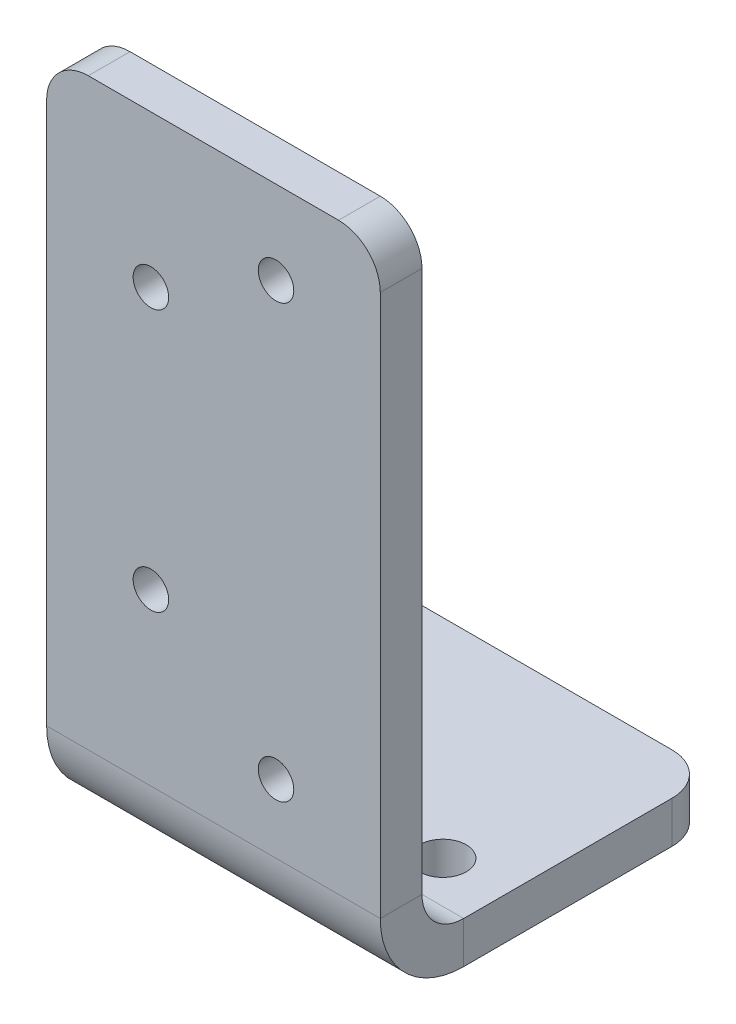
from build123d import *

# Parameters (mm, degrees)
BASE_FLANGE1_DEPTH  = 50.8
SKETCH3_R           = 2.7051
TAB1_DEPTH          = 6.35
SKETCH3_2_R         = 2.7051
CUT_EXTRUDE1_DEPTH  = 12.7
SKETCH4_R           = 3.5687
CUT_EXTRUDE2_DEPTH  = 12.7
FILLET1_R           = 6.35
UNFOLD1_START       = 6.35
UNFOLD1_OUTLINE_W   = 50.8
UNFOLD1_OUTLINE_H   = 14.961835013
UNFOLD1_DEPTH       = 95.25
UNFOLD1_2_OUTLINE_R = 2.7051
UNFOLD1_2_DEPTH     = 6.35
FOLD1_START         = -1.304798
FOLD1_DEPTH         = 92.466633013
FOLD1_START_2       = -6.35
FOLD1_2_OUTLINE_R   = 2.7051
FOLD1_2_DEPTH       = 0.034797996
FOLD1_START_3       = -12.7
FOLD1_3_OUTLINE_R   = 2.7051
FOLD1_3_DEPTH       = 12.7
FOLD1_4_DEPTH       = 50.8


with BuildPart() as part:
    # Base-Flange1: sheet metal written as solids
    # Sketch1 → Base-Flange1 (new body)
    with BuildSketch(Plane(origin=(0, 0, 0), x_dir=(0, 0, -1), z_dir=(1, 0, 0))):
        with BuildLine():
            Line((0, 101.6), (0, 12.7))
            ThreePointArc((0, 12.7), (3.719743879, 3.719743879), (12.7, 0))
            Line((12.7, 0), (50.8, 0))
            Line((50.8, 0), (50.8, 6.35))
            Line((50.8, 6.35), (12.7, 6.35))
            ThreePointArc((12.7, 6.35), (8.209871939, 8.209871939), (6.35, 12.7))
            Line((6.35, 12.7), (6.35, 101.6))
            Line((6.35, 101.6), (0, 101.6))
        make_face()
    extrude(amount=BASE_FLANGE1_DEPTH)

    # Tab1: sheet metal written as solids
    # Sketch3 → Tab1 (add)
    with BuildSketch(Plane(origin=(0, 0, -6.35), x_dir=(-1, 0, 0), z_dir=(0, 0, -1))):
        with Locations((-34.925, 23.114)):
            Circle(SKETCH3_R)
        with Locations((-34.925, 88.9)):
            Circle(SKETCH3_R)
        with Locations((-15.875, 38.608)):
            Circle(SKETCH3_R)
        with Locations((-15.875, 78.486)):
            Circle(SKETCH3_R)
    extrude(amount=-TAB1_DEPTH)

    # Sketch3<2> → Cut-Extrude1 (cut)
    with BuildSketch(Plane(origin=(0, 0, -6.35), x_dir=(-1, 0, 0), z_dir=(0, 0, -1))):
        with Locations(Location((-34.925, 23.114, 0), (0, 0, 90))):
            Circle(SKETCH3_2_R)
        with Locations(Location((-34.925, 88.9, 0), (0, 0, 90))):
            Circle(SKETCH3_2_R)
        with Locations(Location((-15.875, 38.608, 0), (0, 0, 90))):
            Circle(SKETCH3_2_R)
        with Locations(Location((-15.875, 78.486, 0), (0, 0, 90))):
            Circle(SKETCH3_2_R)
    extrude(amount=-CUT_EXTRUDE1_DEPTH, mode=Mode.SUBTRACT)

    # Sketch4 → Cut-Extrude2 (cut)
    with BuildSketch(Plane(origin=(0, 6.35, 0), x_dir=(-1, 0, 0), z_dir=(0, 1, 0))):
        with Locations(Location((-41.275, -19.05, 0), (0, 0, 90))):
            Circle(SKETCH4_R)
        with Locations(Location((-9.525, -41.275, 0), (0, 0, 90))):
            Circle(SKETCH4_R)
    extrude(amount=-CUT_EXTRUDE2_DEPTH, mode=Mode.SUBTRACT)

    # Fillet1
    fillet1_edges = [part.edges().sort_by_distance(p)[0] for p in [
        (50.8, 101.6, -3.175),
        (0, 101.6, -3.175),
        (50.8, 3.175, -50.8),
        (0, 3.175, -50.8),
    ]]
    fillet(fillet1_edges, radius=FILLET1_R)

    # Unfold1: read off the stored shape, not the designer's step
    # Unfold1 outline → Unfold1 (cut)
    with BuildSketch(Plane(origin=(0, 0, 0), x_dir=(1, 0, 0), z_dir=(0, 1, 0)).offset(UNFOLD1_START)):
        with Locations((25.4, 5.219082494)):
            Rectangle(UNFOLD1_OUTLINE_W, UNFOLD1_OUTLINE_H)
    extrude(amount=UNFOLD1_DEPTH, mode=Mode.SUBTRACT)

    # Unfold1 2 outline → Unfold1 2 (add)
    with BuildSketch(Plane(origin=(0, 0, 0), x_dir=(1, 0, 0), z_dir=(0, 1, 0))):
        with BuildLine():
            ThreePointArc((0, -84.811835013), (1.859871939, -89.301963073), (6.35, -91.161835013))
            Line((6.35, -91.161835013), (44.45, -91.161835013))
            ThreePointArc((44.45, -91.161835013), (48.940128061, -89.301963073), (50.8, -84.811835013))
            Line((50.8, -84.811835013), (50.8, 12.7))
            Line((50.8, 12.7), (0, 12.7))
            Line((0, 12.7), (0, -84.811835013))
        make_face()
        with Locations((15.875, -68.047835013)):
            Circle(UNFOLD1_2_OUTLINE_R, mode=Mode.SUBTRACT)
        with Locations((34.925, -78.461835013)):
            Circle(UNFOLD1_2_OUTLINE_R, mode=Mode.SUBTRACT)
        with Locations((15.875, -28.169835013)):
            Circle(UNFOLD1_2_OUTLINE_R, mode=Mode.SUBTRACT)
        with Locations((34.925, -12.675835013)):
            Circle(UNFOLD1_2_OUTLINE_R, mode=Mode.SUBTRACT)
    extrude(amount=UNFOLD1_2_DEPTH)

    # Fold1: read off the stored shape, not the designer's step
    # Fold1 outline → Fold1 (cut)
    with BuildSketch(Plane.XY.offset(FOLD1_START)):
        Polygon((50.8, 0), (50.8, 6.35), (0, 6.35), (0, 9e-09), align=None)
    extrude(amount=FOLD1_DEPTH, mode=Mode.SUBTRACT)

    # Fold1 2 outline → Fold1 2 (add)
    with BuildSketch(Plane.XY.offset(FOLD1_START_2)):
        with BuildLine():
            Line((50.8, 6.35), (50.8, 95.25))
            ThreePointArc((50.8, 95.25), (48.940128061, 99.740128061), (44.45, 101.6))
            Line((44.45, 101.6), (6.35, 101.6))
            ThreePointArc((6.35, 101.6), (1.859871939, 99.740128061), (0, 95.25))
            Line((0, 95.25), (0, 6.35))
            Line((0, 6.35), (50.8, 6.35))
        make_face()
        with Locations((15.875, 38.608)):
            Circle(FOLD1_2_OUTLINE_R, mode=Mode.SUBTRACT)
        with Locations((34.925, 23.114)):
            Circle(FOLD1_2_OUTLINE_R, mode=Mode.SUBTRACT)
        with Locations((15.875, 78.486)):
            Circle(FOLD1_2_OUTLINE_R, mode=Mode.SUBTRACT)
        with Locations((34.925, 88.9)):
            Circle(FOLD1_2_OUTLINE_R, mode=Mode.SUBTRACT)
    extrude(amount=FOLD1_2_DEPTH)

    # Fold1 3 outline → Fold1 3 (add)
    with BuildSketch(Plane.XY.offset(FOLD1_START_3)):
        with BuildLine():
            Line((50.8, 6.35), (50.8, 95.25))
            ThreePointArc((50.8, 95.25), (48.940128061, 99.740128061), (44.45, 101.6))
            Line((44.45, 101.6), (6.35, 101.6))
            ThreePointArc((6.35, 101.6), (1.859871939, 99.740128061), (0, 95.25))
            Line((0, 95.25), (0, 6.35))
            Line((0, 6.35), (50.8, 6.35))
        make_face()
        with Locations((15.875, 38.608)):
            Circle(FOLD1_3_OUTLINE_R, mode=Mode.SUBTRACT)
        with Locations((34.925, 23.114)):
            Circle(FOLD1_3_OUTLINE_R, mode=Mode.SUBTRACT)
        with Locations((15.875, 78.486)):
            Circle(FOLD1_3_OUTLINE_R, mode=Mode.SUBTRACT)
        with Locations((34.925, 88.9)):
            Circle(FOLD1_3_OUTLINE_R, mode=Mode.SUBTRACT)
    extrude(amount=FOLD1_3_DEPTH)

    # Fold1 4 outline → Fold1 4 (cut)
    with BuildSketch(Plane.YZ):
        with BuildLine():
            ThreePointArc((9e-09, -12.7), (3.719743885, -3.719743885), (12.7, -9e-09))
            Line((12.7, -9e-09), (6.35, 0))
            Line((6.35, 0), (6.35, -1.304798))
            Line((6.35, -1.304798), (0, -1.304798))
            Line((0, -1.304798), (9e-09, -12.7))
        make_face()
        with BuildLine():
            Line((101.6, -6.35), (12.7, -6.350000009))
            ThreePointArc((12.7, -6.350000009), (8.209871946, -8.209871946), (6.350000009, -12.7))
            Line((6.350000009, -12.7), (101.6, -12.7))
            Line((101.6, -12.7), (101.6, -6.35))
        make_face()
    extrude(amount=FOLD1_4_DEPTH, mode=Mode.SUBTRACT)


solid = part.part
